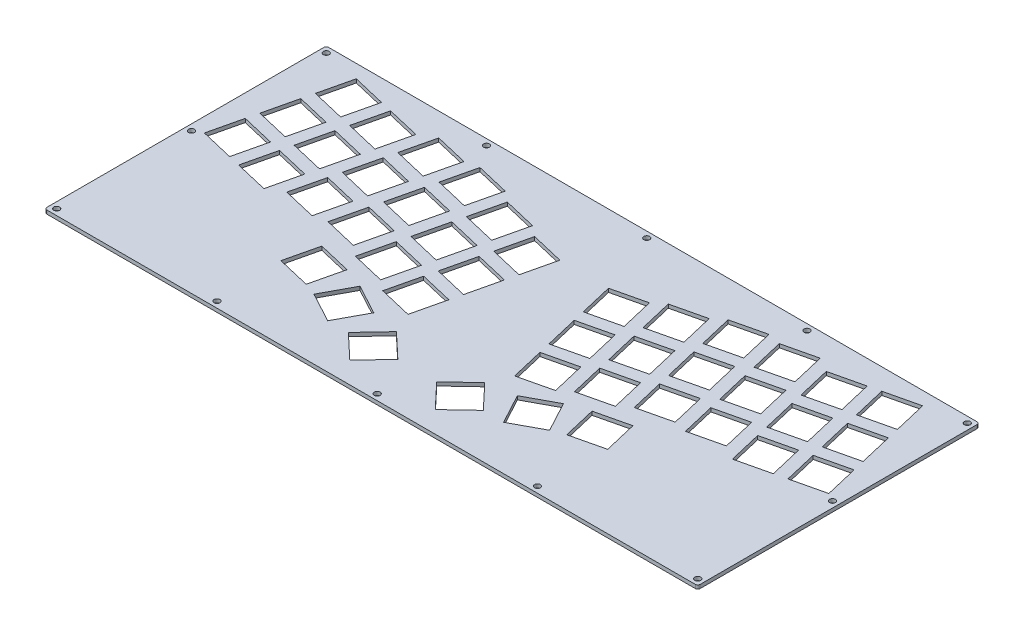
from build123d import *

# Parameters (mm, degrees)
SKETCH2_W                       = 269
SKETCH2_H                       = 116
BASE_FLANGE1_DEPTH              = 1.5
FILLET1_R                       = 1
LEFT_HAND_SWITCH_CUTOUTS_DEPTH  = 10
F_2_4_2_4_MOUNTING_HOLE_SEED_D  = 2.4
MOUNTING_START                  = -1.5
MOUNTING_HOLE_PATTERN_OUTLINE_R = 1.2
MOUNTING_HOLE_PATTERN_DEPTH     = 1.5


# Read off the part's stored shape, not the designer's step: mounting hole pattern
# Sheet-metal steps are written as plain solids
with BuildPart() as part:
    # Sketch2 → Base-Flange1 (new body)
    with BuildSketch(Plane(origin=(0, 0, 0), x_dir=(1, 0, 0), z_dir=(0, 1, 0))):
        with Locations((0, -14.07739973)):
            Rectangle(SKETCH2_W, SKETCH2_H)
    extrude(amount=-BASE_FLANGE1_DEPTH)

    # Fillet1
    fillet1_edges = [part.edges().sort_by_distance(p)[0] for p in [
        (-134.5, -0.75, -43.92260027),
        (134.5, -0.75, -43.92260027),
        (134.5, -0.75, 72.07739973),
        (-134.5, -0.75, 72.07739973),
    ]]
    fillet(fillet1_edges, radius=FILLET1_R)

    # Sketch7 → left hand switch cutouts (cut)
    with BuildSketch(Plane(origin=(0, 0, 0), x_dir=(1, 0, 0), z_dir=(0, 1, 0))):
        Polygon((-98.137441907, 34.051655263), (-101.358138228, 20.427151044), (-87.733634009, 17.206454724), (-84.512937688, 30.830958943), align=None)
        Polygon((-116.62784049, 38.42260027), (-119.84853681, 24.798096051), (-106.224032591, 21.57739973), (-103.003336271, 35.201903949), align=None)
        Polygon((-41.573509907, 25.561419889), (-44.794206228, 11.93691567), (-31.169702009, 8.71621935), (-27.949005688, 22.340723569), align=None)
        Polygon((-59.517310314, 32.244637897), (-62.738006635, 18.620133679), (-49.113502416, 15.399437358), (-45.892806095, 29.023941577), align=None)
        Polygon((-78.554307073, 34.303309902), (-81.775003393, 20.678805683), (-68.150499174, 17.458109363), (-64.929802854, 31.082613582), align=None)
        Polygon((-41.90057838, -34.788784505), (-48.537813307, -47.115467454), (-36.211130358, -53.752702381), (-29.573895431, -41.426019431), align=None)
        Polygon((-64.071379608, -28.337583116), (-67.292075929, -41.962087334), (-53.66757171, -45.182783655), (-50.44687539, -31.558279436), align=None)
        Polygon((-23.62947945, 18.87917506), (-26.850175771, 5.254670841), (-13.225671552, 2.03397452), (-10.004975231, 15.658478739), align=None)
        Polygon((-102.508386913, 15.56125668), (-105.729083234, 1.936752462), (-92.104579015, -1.283943859), (-88.883882695, 12.34056036), align=None)
        Polygon((-120.998785496, 19.932201687), (-124.219481817, 6.307697468), (-110.594977598, 3.087001147), (-107.374281277, 16.711505366), align=None)
        Polygon((-18.188818607, -43.485973289), (-27.790275548, -53.674791896), (-17.601456941, -63.276248837), (-8, -53.08743023), align=None)
        Polygon((-28.000424457, 0.388776477), (-31.221120777, -13.235727742), (-17.596616558, -16.456424063), (-14.375920238, -2.831919844), align=None)
        Polygon((-45.944454914, 7.071021306), (-49.165151234, -6.553482912), (-35.540647015, -9.774179233), (-32.319950695, 3.850324986), align=None)
        Polygon((-63.888255321, 13.754239315), (-67.108951641, 0.129735096), (-53.484447423, -3.090961225), (-50.263751102, 10.533542994), align=None)
        Polygon((-82.925252079, 15.81291132), (-86.1459484, 2.188407101), (-72.521444181, -1.03228922), (-69.30074786, 12.592214999), align=None)
        Polygon((-106.87933192, -2.929141902), (-110.100028241, -16.553646121), (-96.475524022, -19.774342442), (-93.254827701, -6.149838223), align=None)
        Polygon((-125.369730503, 1.441803104), (-128.590426823, -12.182701115), (-114.965922605, -15.403397435), (-111.745226284, -1.778893216), align=None)
        Polygon((-32.371369463, -18.101622106), (-35.592065784, -31.726126325), (-21.967561565, -34.946822645), (-18.746865244, -21.322318426), align=None)
        Polygon((-50.31539992, -11.419377276), (-53.536096241, -25.043881495), (-39.911592022, -28.264577816), (-36.690895701, -14.640073597), align=None)
        Polygon((-68.259200327, -4.736159268), (-71.479896648, -18.360663487), (-57.855392429, -21.581359808), (-54.634696108, -7.956855589), align=None)
        Polygon((-76.892389187, -19.522687803), (-73.671692867, -5.898183584), (-87.296197086, -2.677487263), (-90.516893406, -16.301991482), align=None)
    left_hand_switch_cutouts = extrude(amount=-LEFT_HAND_SWITCH_CUTOUTS_DEPTH, mode=Mode.SUBTRACT)

    # right hand switch cutouts: left hand switch cutouts across plane
    add(left_hand_switch_cutouts.mirror(Plane(origin=(0, 0, 0), x_dir=(0, 0, 1), z_dir=(1, 0, 0))), mode=Mode.SUBTRACT)

    # Ø2.4 (2.4) mounting hole seed (through all)
    with Locations(Plane(origin=(0, 0, 0), x_dir=(1, 0, 0), z_dir=(0, 1, 0))):
        with Locations((-132, 41.42260027)):
            Hole(F_2_4_2_4_MOUNTING_HOLE_SEED_D / 2)

    # mounting hole pattern outline → mounting hole pattern (cut)
    with BuildSketch(Plane(origin=(0, 0, 0), x_dir=(1, 0, 0), z_dir=(0, 1, 0)).offset(MOUNTING_START)):
        with Locations((-66, 41.42260027)):
            Circle(MOUNTING_HOLE_PATTERN_OUTLINE_R)
        with Locations((0, 41.42260027)):
            Circle(MOUNTING_HOLE_PATTERN_OUTLINE_R)
        with Locations((66, 41.42260027)):
            Circle(MOUNTING_HOLE_PATTERN_OUTLINE_R)
        with Locations((132, 41.42260027)):
            Circle(MOUNTING_HOLE_PATTERN_OUTLINE_R)
        with Locations((-132, -14.07739973)):
            Circle(MOUNTING_HOLE_PATTERN_OUTLINE_R)
        with Locations((132, -14.07739973)):
            Circle(MOUNTING_HOLE_PATTERN_OUTLINE_R)
        with Locations((-132, -69.57739973)):
            Circle(MOUNTING_HOLE_PATTERN_OUTLINE_R)
        with Locations((-66, -69.57739973)):
            Circle(MOUNTING_HOLE_PATTERN_OUTLINE_R)
        with Locations((0, -69.57739973)):
            Circle(MOUNTING_HOLE_PATTERN_OUTLINE_R)
        with Locations((66, -69.57739973)):
            Circle(MOUNTING_HOLE_PATTERN_OUTLINE_R)
        with Locations((132, -69.57739973)):
            Circle(MOUNTING_HOLE_PATTERN_OUTLINE_R)
    extrude(amount=MOUNTING_HOLE_PATTERN_DEPTH, mode=Mode.SUBTRACT)


solid = part.part
